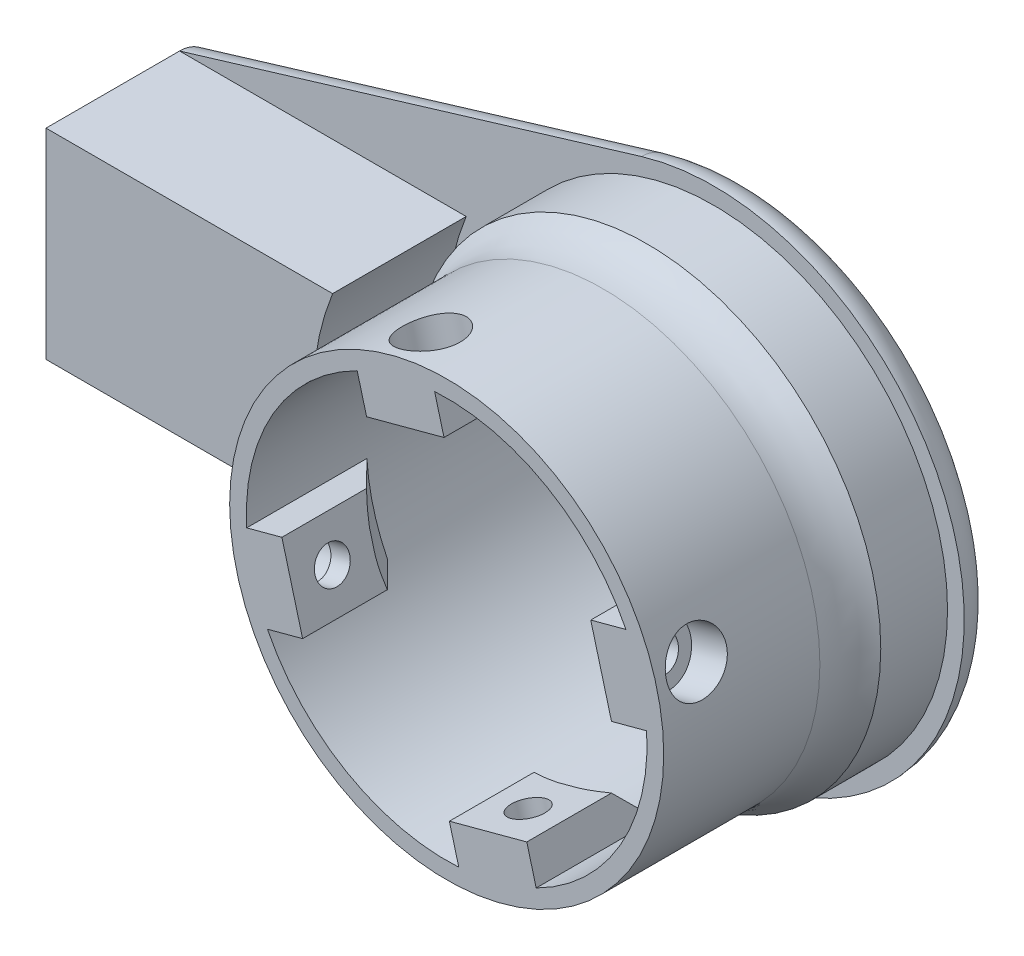
from build123d import *

# Parameters (mm, degrees)
ESQUISSE1_R                               = 30
BOSS_EXTRU_1_DEPTH                        = 5
ESQUISSE6_R                               = 35
ESQUISSE6_R_2                             = 30
BOSS_EXTRU_6_DEPTH                        = 10
ESQUISSE7_R                               = 32.5
ESQUISSE7_R_2                             = 30
BOSS_EXTRU_8_DEPTH                        = 30
CONG_2_R                                  = 10
BOSS_EXTRU_9_DEPTH                        = 20
BOSS_EXTRU_10_DEPTH                       = 12
CHANFREIN1_SIZE                           = 6
CONG_3_R                                  = 5
ENL_V_MAT_EXTRU_1_REACH                   = 89.234
ENL_V_MAT_EXTRU_1_END_RADIUS              = 32.5
ESQUISSE10_R                              = 4.5
ESQUISSE11_R                              = 4.5
ESQUISSE11_R_2                            = 2.6
BOSS_EXTRU_11_DEPTH                       = 3
R_P_TITION_CIRCULAIRE1_COUNT              = 4
CHANFREIN1_OF_R_P_TITION_CIRCULAIRE1_SIZE = 6


# Some blends are built 0.0001 mm under size
with BuildPart() as part:
    # Esquisse1 → Boss.-Extru.1 (new body)
    with BuildSketch(Plane.XY):
        with BuildLine():
            Line((-10.847469364, 35.896830061), (-80, 15))
            Line((-80, 15), (-80, -15))
            Line((-80, -15), (-10.847469364, -35.896830061))
            ThreePointArc((-10.847469364, -35.896830061), (37.5, 0), (-10.847469364, 35.896830061))
        make_face()
        Circle(ESQUISSE1_R, mode=Mode.SUBTRACT)
    extrude(amount=BOSS_EXTRU_1_DEPTH)

    # Esquisse6 → Boss.-Extru.6 (add)
    with BuildSketch(Plane.XY.offset(5)):
        Circle(ESQUISSE6_R)
        Circle(ESQUISSE6_R_2, mode=Mode.SUBTRACT)
    extrude(amount=BOSS_EXTRU_6_DEPTH)

    # Esquisse7 → Boss.-Extru.8 (add)
    with BuildSketch(Plane.XY.offset(15)):
        Circle(ESQUISSE7_R)
        Circle(ESQUISSE7_R_2, mode=Mode.SUBTRACT)
    extrude(amount=BOSS_EXTRU_8_DEPTH)

    # Congé2
    # the kernel refuses this fillet: 10 mm, written as the material it adds along each edge
    with BuildSketch(Plane(origin=(0, 0, 15), x_dir=(1, 0, 0), z_dir=(0, -1, 0))) as cong_2_piece_1:
        with BuildLine():
            CenterArc((42.5, 6.614378278), CONG_2_R, 180, 41.409622109)
            Line((32.5, 6.614378278), (32.3, 6.614378278))
            Line((32.3, 6.614378278), (32.3, 0))
            Line((32.3, 0), (32.5, -0.2))
            ThreePointArc((32.5, -0.2), (33.75, -0.2), (34.85, -0.132287566))
            Line((34.85, -0.132287566), (35, 0))
        make_face()
    revolve(axis=Axis((0, 0, 15), (0, 0, 1)))

    # Esquisse8 → Boss.-Extru.9 (add)
    with BuildSketch(Plane.XY.offset(5)):
        with BuildLine():
            Line((-80, 15), (-37.080992435, 15))
            ThreePointArc((-37.080992435, 15), (-40, 0), (-37.080992435, -15))
            Line((-37.080992435, -15), (-80, -15))
            Line((-80, -15), (-80, 15))
        make_face()
    extrude(amount=BOSS_EXTRU_9_DEPTH)

    # Esquisse9 → Boss.-Extru.10 (add)
    with BuildSketch(Plane.XY.offset(45)):
        Polygon((-32.405891584, -2.471475398), (-29.300063043, -14.062585313), (-21.572656433, -11.992032952), (-24.678484974, -0.400923037), align=None)
    boss_extru_10 = extrude(amount=-BOSS_EXTRU_10_DEPTH)

    # Chanfrein1
    # the kernel refuses this chamfer: 6 mm, written as the material it adds along each edge
    with BuildSketch(Plane(origin=(0, 0, 33), x_dir=(-0.5590908430517356, -0.8291064040373223, 0), z_dir=(0.8291064040373223, -0.5590908430517356, 0))) as chanfrein1_piece_1_section:
        Polygon((30, CHANFREIN1_SIZE), (30 - CHANFREIN1_SIZE, 0), (30, 0), align=None)
    chanfrein1_piece_1 = revolve(axis=Axis((0, 0, 33), (0, 0, -1)), revolution_arc=82.01410645, mode=Mode.PRIVATE)
    chanfrein1_piece_1 = split(chanfrein1_piece_1, bisect_by=Plane(origin=(-25.327272202, -12.998079215, 31.008979001), z_dir=(-0.25881904510251486, 0.96592582628907, 0)), keep=Keep.TOP, mode=Mode.PRIVATE)
    chanfrein1_piece_1 = split(chanfrein1_piece_1, bisect_by=Plane(origin=(-28.433100743, -1.4069693, 31.008979001), z_dir=(0.2588190451025147, -0.96592582628907, 0)), keep=Keep.TOP, mode=Mode.PRIVATE)
    chanfrein1_piece_1 = split(chanfrein1_piece_1, bisect_by=Plane(origin=(-23.125570703, -6.196477994, 31.008979001), z_dir=(-0.9659258262890699, -0.2588190451025148, 0)), keep=Keep.TOP, mode=Mode.PRIVATE)
    add(chanfrein1_piece_1)

    # Congé3
    cong_3_edges = [part.edges().sort_by_distance(p)[0] for p in [
        (37.5, 0, 0),
        (-45.423734682, 25.44841503, 0),
        (-45.423734682, -25.44841503, 0),
    ]]
    fillet(cong_3_edges, radius=CONG_3_R - 0.0001)  # a hair under: the kernel refuses the full size

    # Enlèv. mat.-Extru.1: up to this cylinder (the profile starts inside it)
    enl_v_mat_extru_1_end = Plane(origin=(0, 0, 39), z_dir=(0, 0, -1)) * Cylinder(ENL_V_MAT_EXTRU_1_END_RADIUS, 244.468, mode=Mode.PRIVATE)
    # Esquisse10 → Enlèv. mat.-Extru.1 (cut, up to the surface)
    with BuildSketch(Plane(origin=(-23.125570703, -6.196477994, 0), x_dir=(0, 0, -1), z_dir=(0.96592582628907, 0.25881904510251497, 0)), mode=Mode.PRIVATE) as enl_v_mat_extru_1_sk1:
        with Locations(Location((-39, 0, 0), (0, 0, 90))):
            Circle(ESQUISSE10_R)
    enl_v_mat_extru_1_tool1 = extrude(enl_v_mat_extru_1_sk1.sketch, amount=-ENL_V_MAT_EXTRU_1_REACH, mode=Mode.PRIVATE) & enl_v_mat_extru_1_end
    enl_v_mat_extru_1 = enl_v_mat_extru_1_tool1.solids().sort_by_distance((-23.125571, -6.196478, 39))[0]
    add(enl_v_mat_extru_1, mode=Mode.SUBTRACT)

    # Esquisse11 → Boss.-Extru.11 (add)
    with BuildSketch(Plane(origin=(-23.125570703, -6.196477994, 0), x_dir=(0, 0, -1), z_dir=(0.96592582628907, 0.25881904510251497, 0))):
        with Locations(Location((-39, 0, 0), (0, 0, 90))):
            Circle(ESQUISSE11_R)
        with Locations(Location((-39, 0, 0), (0, 0, 90))):
            Circle(ESQUISSE11_R_2, mode=Mode.SUBTRACT)
    boss_extru_11 = extrude(amount=-BOSS_EXTRU_11_DEPTH)

    # Répétition circulaire1: Boss.-Extru.10, Enlèv. mat.-Extru.1, Boss.-Extru.11 ×4 about axis
    r_p_tition_circulaire1_axis = Axis((0, 0, 0), (0, 0, 1))
    add([boss_extru_10.rotate(r_p_tition_circulaire1_axis, i * 360 / R_P_TITION_CIRCULAIRE1_COUNT) for i in range(1, R_P_TITION_CIRCULAIRE1_COUNT)])
    add([enl_v_mat_extru_1.rotate(r_p_tition_circulaire1_axis, i * 360 / R_P_TITION_CIRCULAIRE1_COUNT) for i in range(1, R_P_TITION_CIRCULAIRE1_COUNT)], mode=Mode.SUBTRACT)
    add([boss_extru_11.rotate(r_p_tition_circulaire1_axis, i * 360 / R_P_TITION_CIRCULAIRE1_COUNT) for i in range(1, R_P_TITION_CIRCULAIRE1_COUNT)])

    # Chanfrein1 of Répétition circulaire1
    # the kernel refuses this chamfer: 6 mm, written as the material it adds along each edge
    with BuildSketch(Plane(origin=(0, 0, 33), x_dir=(0.8291064040373222, -0.559090843051736, 0), z_dir=(0.559090843051736, 0.8291064040373222, 0))) as chanfrein1_of_r_p_tition_circulaire1_piece_1_section:
        Polygon((30, CHANFREIN1_OF_R_P_TITION_CIRCULAIRE1_SIZE), (30 - CHANFREIN1_OF_R_P_TITION_CIRCULAIRE1_SIZE, 0), (30, 0), align=None)
    chanfrein1_of_r_p_tition_circulaire1_piece_1 = revolve(axis=Axis((0, 0, 33), (0, 0, -1)), revolution_arc=82.01410645, mode=Mode.PRIVATE)
    chanfrein1_of_r_p_tition_circulaire1_piece_1 = split(chanfrein1_of_r_p_tition_circulaire1_piece_1, bisect_by=Plane(origin=(12.998079215, -25.327272202, 31.008979001), z_dir=(-0.96592582628907, -0.25881904510251474, 0)), keep=Keep.TOP, mode=Mode.PRIVATE)
    chanfrein1_of_r_p_tition_circulaire1_piece_1 = split(chanfrein1_of_r_p_tition_circulaire1_piece_1, bisect_by=Plane(origin=(1.4069693, -28.433100743, 31.008979001), z_dir=(0.96592582628907, 0.2588190451025146, 0)), keep=Keep.TOP, mode=Mode.PRIVATE)
    chanfrein1_of_r_p_tition_circulaire1_piece_1 = split(chanfrein1_of_r_p_tition_circulaire1_piece_1, bisect_by=Plane(origin=(6.196477994, -23.125570703, 31.008979001), z_dir=(0.25881904510251474, -0.9659258262890701, 0)), keep=Keep.TOP, mode=Mode.PRIVATE)
    add(chanfrein1_of_r_p_tition_circulaire1_piece_1)
    with BuildSketch(Plane(origin=(0, 0, 33), x_dir=(0.5590908430517355, 0.8291064040373223, 0), z_dir=(-0.8291064040373223, 0.5590908430517355, 0))) as chanfrein1_of_r_p_tition_circulaire1_piece_2_section:
        Polygon((30, CHANFREIN1_OF_R_P_TITION_CIRCULAIRE1_SIZE), (30 - CHANFREIN1_OF_R_P_TITION_CIRCULAIRE1_SIZE, 0), (30, 0), align=None)
    chanfrein1_of_r_p_tition_circulaire1_piece_2 = revolve(axis=Axis((0, 0, 33), (0, 0, -1)), revolution_arc=82.01410645, mode=Mode.PRIVATE)
    chanfrein1_of_r_p_tition_circulaire1_piece_2 = split(chanfrein1_of_r_p_tition_circulaire1_piece_2, bisect_by=Plane(origin=(25.327272202, 12.998079215, 31.008979001), z_dir=(0.25881904510251474, -0.96592582628907, 0)), keep=Keep.TOP, mode=Mode.PRIVATE)
    chanfrein1_of_r_p_tition_circulaire1_piece_2 = split(chanfrein1_of_r_p_tition_circulaire1_piece_2, bisect_by=Plane(origin=(28.433100743, 1.4069693, 31.008979001), z_dir=(-0.2588190451025146, 0.96592582628907, 0)), keep=Keep.TOP, mode=Mode.PRIVATE)
    chanfrein1_of_r_p_tition_circulaire1_piece_2 = split(chanfrein1_of_r_p_tition_circulaire1_piece_2, bisect_by=Plane(origin=(23.125570703, 6.196477994, 31.008979001), z_dir=(0.9659258262890701, 0.25881904510251474, 0)), keep=Keep.TOP, mode=Mode.PRIVATE)
    add(chanfrein1_of_r_p_tition_circulaire1_piece_2)
    with BuildSketch(Plane(origin=(0, 0, 33), x_dir=(-0.8291064040373223, 0.5590908430517356, 0), z_dir=(-0.5590908430517356, -0.8291064040373223, 0))) as chanfrein1_of_r_p_tition_circulaire1_piece_3_section:
        Polygon((30, CHANFREIN1_OF_R_P_TITION_CIRCULAIRE1_SIZE), (30 - CHANFREIN1_OF_R_P_TITION_CIRCULAIRE1_SIZE, 0), (30, 0), align=None)
    chanfrein1_of_r_p_tition_circulaire1_piece_3 = revolve(axis=Axis((0, 0, 33), (0, 0, -1)), revolution_arc=82.01410645, mode=Mode.PRIVATE)
    chanfrein1_of_r_p_tition_circulaire1_piece_3 = split(chanfrein1_of_r_p_tition_circulaire1_piece_3, bisect_by=Plane(origin=(-12.998079215, 25.327272202, 31.008979001), z_dir=(0.9659258262890701, 0.25881904510251463, 0)), keep=Keep.TOP, mode=Mode.PRIVATE)
    chanfrein1_of_r_p_tition_circulaire1_piece_3 = split(chanfrein1_of_r_p_tition_circulaire1_piece_3, bisect_by=Plane(origin=(-1.4069693, 28.433100743, 31.008979001), z_dir=(-0.9659258262890701, -0.25881904510251447, 0)), keep=Keep.TOP, mode=Mode.PRIVATE)
    chanfrein1_of_r_p_tition_circulaire1_piece_3 = split(chanfrein1_of_r_p_tition_circulaire1_piece_3, bisect_by=Plane(origin=(-6.196477994, 23.125570703, 31.008979001), z_dir=(-0.2588190451025146, 0.96592582628907, 0)), keep=Keep.TOP, mode=Mode.PRIVATE)
    add(chanfrein1_of_r_p_tition_circulaire1_piece_3)


solid = part.part
